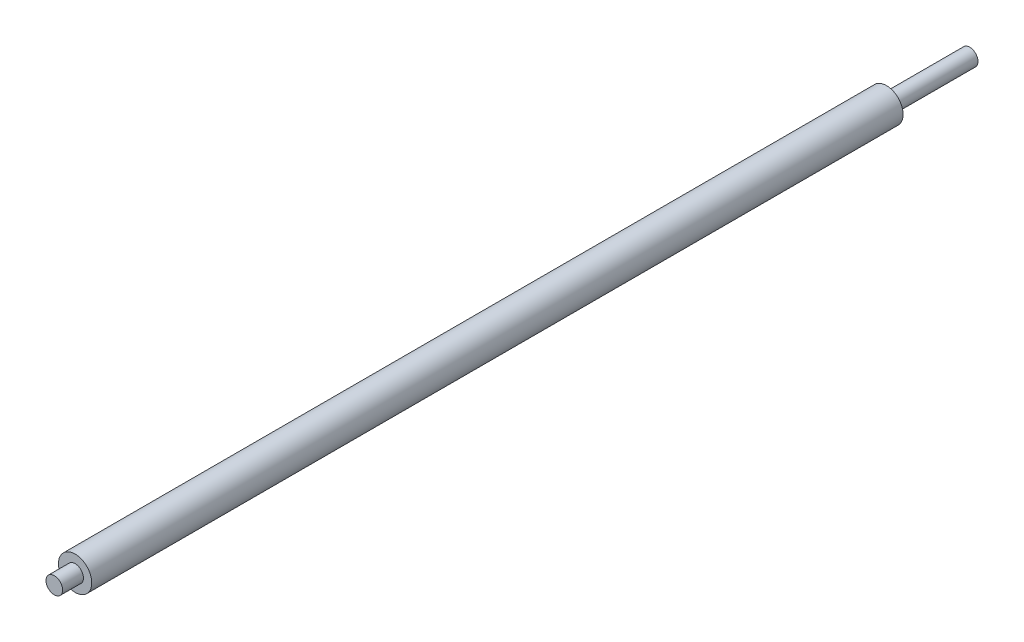
from build123d import *

# Parameters (mm, degrees)
SKETCH1_R           = 6
BOSS_EXTRUDE1_DEPTH = 146.25
SKETCH2_R           = 3
BOSS_EXTRUDE2_DEPTH = 7.5
BOSS_EXTRUDE3_START = 30
SKETCH3_R           = 3
BOSS_EXTRUDE3_DEPTH = 30


with BuildPart() as part:
    # Sketch1 → Boss-Extrude1 (new, symmetric)
    with BuildSketch(Plane.XY):
        Circle(SKETCH1_R)
    extrude(amount=BOSS_EXTRUDE1_DEPTH, both=True)

    # Sketch2 → Boss-Extrude2 (add)
    with BuildSketch(Plane.XY.offset(146.25)):
        Circle(SKETCH2_R)
    extrude(amount=BOSS_EXTRUDE2_DEPTH)

    # Sketch3 → Boss-Extrude3 (add)
    with BuildSketch(Plane(origin=(0, 0, -146.25), x_dir=(-1, 0, 0), z_dir=(0, 0, -1)).offset(BOSS_EXTRUDE3_START)):
        Circle(SKETCH3_R)
    extrude(amount=-BOSS_EXTRUDE3_DEPTH)


solid = part.part
